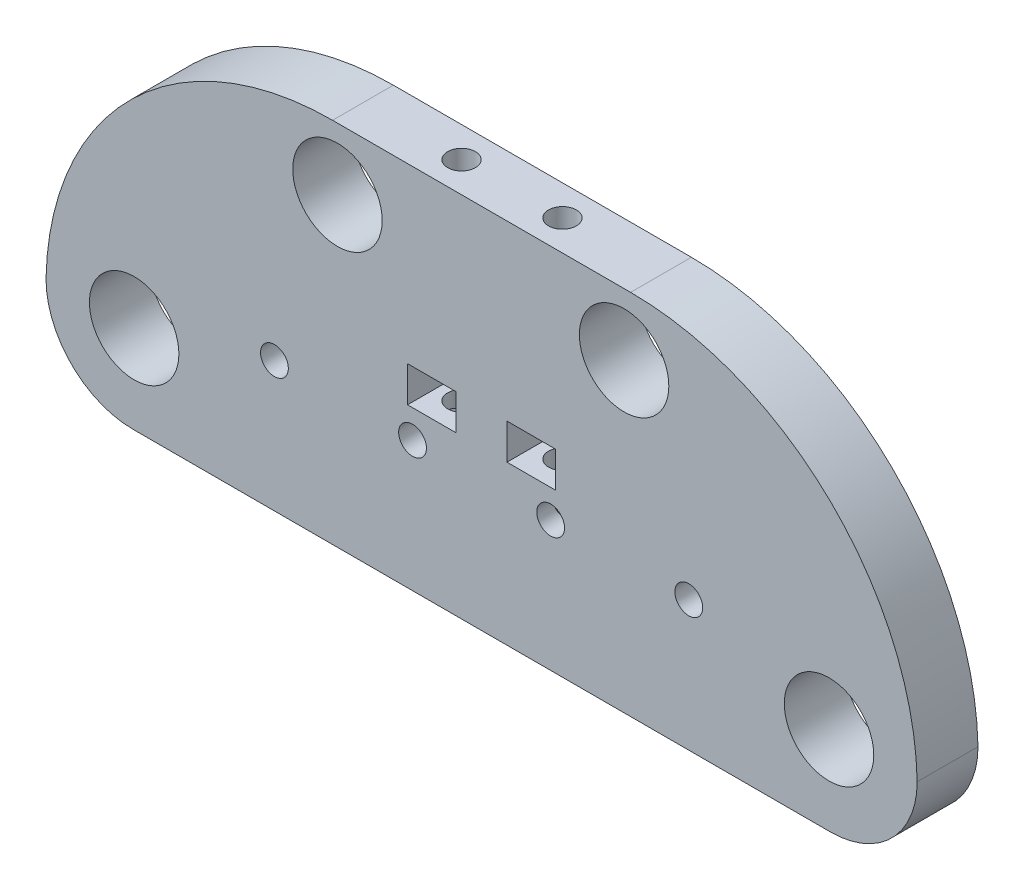
from build123d import *

# Parameters (mm, degrees)
ESBO_O1_W                = 100.3
ESBO_O1_H                = 42.3
ESBO_O1_R                = 5.15
ESBO_O1_R_2              = 1.6
ESBO_O1_W_2              = 5.6
ESBO_O1_H_2              = 4.1
RESSALTO_EXTRUS_O1_DEPTH = 7
FILETE1_R                = 10
ESBO_O4_R                = 1.6
CORTE_EXTRUS_O3_DEPTH    = 67.046091306
FILETE3_R                = 33


with BuildPart() as part:
    # Esboço1 → Ressalto-extrusão1 (new body)
    with BuildSketch(Plane.XY):
        with Locations((0.087398189, -10.441132561)):
            Rectangle(ESBO_O1_W, ESBO_O1_H)
        with Locations((-16.508590221, 3.558867439)):
            Circle(ESBO_O1_R, mode=Mode.SUBTRACT)
        with Locations((16.491409779, 3.558867439)):
            Circle(ESBO_O1_R, mode=Mode.SUBTRACT)
        with Locations((-39.912601811, -21.441132561)):
            Circle(ESBO_O1_R, mode=Mode.SUBTRACT)
        with Locations((40.087398189, -21.441132561)):
            Circle(ESBO_O1_R, mode=Mode.SUBTRACT)
        with Locations((8.037398189, -16.591132561)):
            Circle(ESBO_O1_R_2, mode=Mode.SUBTRACT)
        with Locations((23.937398189, -16.591132561)):
            Circle(ESBO_O1_R_2, mode=Mode.SUBTRACT)
        with Locations((-7.862601811, -16.591132561)):
            Circle(ESBO_O1_R_2, mode=Mode.SUBTRACT)
        with Locations((-23.762601811, -16.591132561)):
            Circle(ESBO_O1_R_2, mode=Mode.SUBTRACT)
        with Locations((-5.635596016, -11.291132561)):
            Rectangle(ESBO_O1_W_2, ESBO_O1_H_2, mode=Mode.SUBTRACT)
        with Locations((5.810392394, -11.291132561)):
            Rectangle(ESBO_O1_W_2, ESBO_O1_H_2, mode=Mode.SUBTRACT)
    extrude(amount=RESSALTO_EXTRUS_O1_DEPTH)

    # Filete1
    filete1_edges = [part.edges().sort_by_distance(p)[0] for p in [
        (50.237398189, -31.591132561, 3.5),
        (-50.062601811, -31.591132561, 3.5),
    ]]
    fillet(filete1_edges, radius=FILETE1_R)

    # Esboço4 → Corte-extrusão3 (cut, through all)
    with BuildSketch(Plane(origin=(0, 10.708867439, 0), x_dir=(1, 0, 0), z_dir=(0, 1, 0))):
        with Locations(Location((-5.722601811, -3.5, 0), (0, 0, 270))):
            Circle(ESBO_O4_R)
        with Locations(Location((5.897398189, -3.5, 0), (0, 0, 270))):
            Circle(ESBO_O4_R)
    extrude(amount=-CORTE_EXTRUS_O3_DEPTH, mode=Mode.SUBTRACT)

    # Filete3
    # the kernel refuses this fillet: 33 mm, written as the material it takes off along each edge
    with BuildSketch(Plane(origin=(50.237398189, 10.708867439, -82.481437306), x_dir=(0, -1, 0), z_dir=(0, 0, 1))) as filete3_piece_1:
        with BuildLine():
            CenterArc((33, -32.992574922), FILETE3_R, 91.215456182, 88.784543818)
            Line((0, -32.992574922), (0, 0))
            Line((0, 0), (32.3, 0))
        make_face()
    extrude(amount=171.962874611, mode=Mode.SUBTRACT)
    with BuildSketch(Plane(origin=(-50.062601811, 10.708867439, -82.481437306), x_dir=(0, -1, 0), z_dir=(0, 0, 1))) as filete3_piece_2:
        with BuildLine():
            CenterArc((33, 32.992574922), FILETE3_R, 180, 88.784543818)
            Line((0, 32.992574922), (0, 0))
            Line((0, 0), (32.3, 0))
        make_face()
    extrude(amount=171.962874611, mode=Mode.SUBTRACT)


solid = part.part
